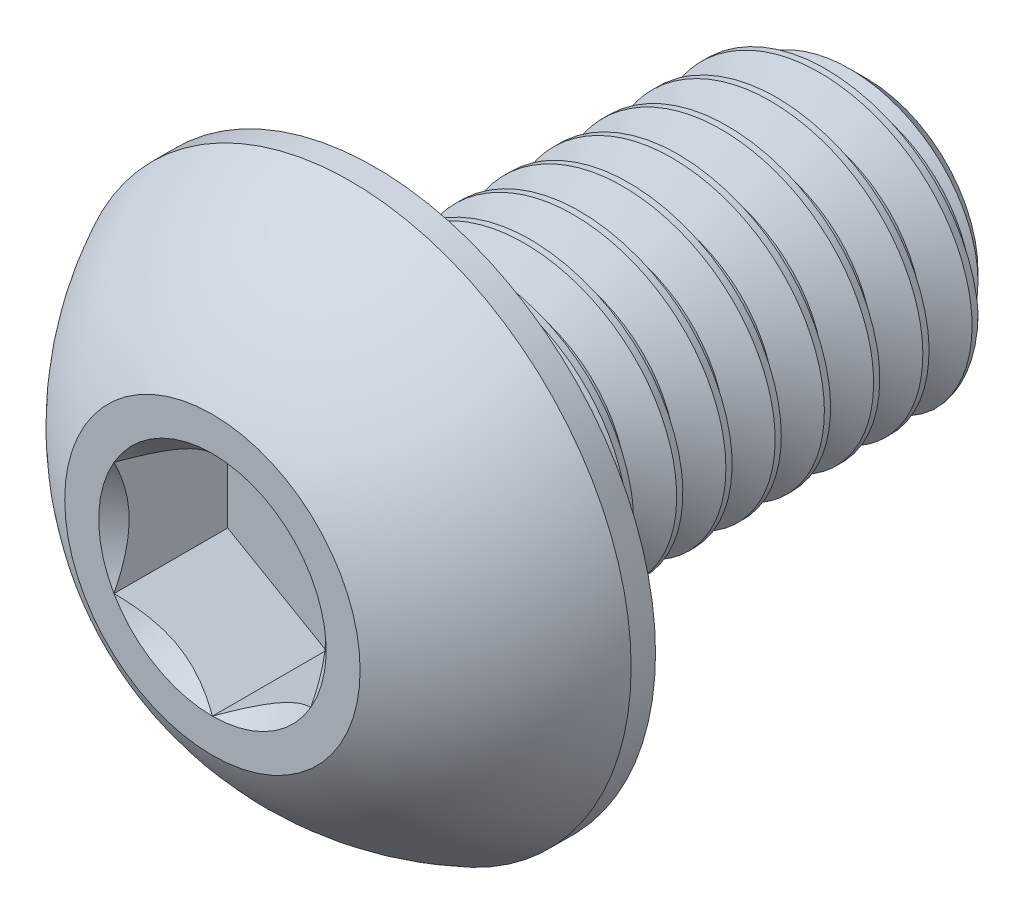
from build123d import *

# Parameters (mm, degrees)
SKETCH1_W              = 5
SKETCH1_H              = 1.5
CUT_EXTRUDE2_DEPTH     = 1.155
SPLIT1_SURFACE_1_BACK  = 11.45
SPLIT1_SURFACE_1_DEPTH = 22.9
SPLIT1_SURFACE_2_BACK  = 11.45
SPLIT1_SURFACE_2_DEPTH = 22.9
CHAMFER1_SIZE          = 0.375
CUT_SWEEP1_PITCH       = 0.5


with BuildPart() as part:
    # Sketch1 → Revolve1 (revolve)
    with BuildSketch(Plane(origin=(0, 0, 0), x_dir=(0, 0, -1), z_dir=(1, 0, 0))):
        with Locations((4.15, 0.75)):
            Rectangle(SKETCH1_W, SKETCH1_H)
    revolve(axis=Axis((0, 0, -6.65), (0, 0, 1)))

    # Sketch7 → Revolve2 (revolve)
    with BuildSketch(Plane(origin=(0, 0, 0), x_dir=(0, 0, -1), z_dir=(1, 0, 0)), mode=Mode.PRIVATE) as revolve2_sk:
        with BuildLine():
            Line((1.4025, 2.85), (1.65, 2.85))
            Line((1.65, 2.85), (1.65, 0))
            Line((1.65, 0), (0, 0))
            Line((0, 0), (0, 1.5))
            ThreePointArc((0, 1.5), (0.59512511, 2.285251969), (1.4025, 2.85))
        make_face()
    revolve(revolve2_sk.sketch.rotate(Axis((0, 0, 0), (0, 0, -1)), 180), axis=Axis((0, 0, 0), (0, 0, -1)))

    # Sketch5 → Cut-Extrude2 (cut)
    with BuildSketch(Plane.XY):
        Polygon((1, -0.577350269), (1, 0.577350269), (0, 1.154700538), (-1, 0.577350269), (-1, -0.577350269), (0, -1.154700538), align=None)
    extrude(amount=-CUT_EXTRUDE2_DEPTH, mode=Mode.SUBTRACT)

    # Cut-Extrude3 cone 1 section (through the dimple's axis) → Cut-Extrude3 (revolve, cut)
    with BuildSketch(Plane(origin=(0, 0, 0), x_dir=(0, -1, 0), z_dir=(1, 0, 0))):
        Polygon((0, 0), (1.154700538, 0), (0, 1.154700538), align=None)
    revolve(axis=Axis((0, 0, 0), (0, 0, -1)), mode=Mode.SUBTRACT)


with BuildPart() as body_2:
    # Split1: the piece behind the surface
    add(part.part)
    # Split1 surface: a surface, the sketch's curves swept straight by 22.9 mm
    with BuildLine(Plane(origin=(0, 0, 0), x_dir=(0, 0, -1), z_dir=(1, 0, 0)).offset(-SPLIT1_SURFACE_1_BACK), mode=Mode.PRIVATE) as split1_surface_1_path:
        Line((1.65, -2.85), (1.65, 2.85))
    split1_surface_1 = Shell.extrude(split1_surface_1_path.wire(), (1 * SPLIT1_SURFACE_1_DEPTH, 0 * SPLIT1_SURFACE_1_DEPTH, 0 * SPLIT1_SURFACE_1_DEPTH))
    split(bisect_by=split1_surface_1, keep=Keep.BOTTOM)

    # Chamfer1
    chamfer1_edges = [body_2.edges().sort_by_distance(p)[0] for p in [
        (0, -1.5, -6.65),
    ]]
    chamfer(chamfer1_edges, length=CHAMFER1_SIZE)

    # Cut-Sweep1: the profile of Sketch2 screwed along a right-hand helix of 11 turns, 6 arcs to a turn; built about Z, then put on its axis
    cut_sweep1_z = Axis((0, 0, 0), (0, 0, 1))
    cut_sweep1_corners = [(1.175240474, 0, -0.1875), (1.175240474, 0, -0.25), (1.527063294, 0, -0.453125), (1.527063294, 0, 0.015625)]
    with BuildLine(mode=Mode.PRIVATE) as cut_sweep1_profile:
        Line(cut_sweep1_corners[0], cut_sweep1_corners[1])
        Line(cut_sweep1_corners[1], cut_sweep1_corners[2])
        Line(cut_sweep1_corners[2], cut_sweep1_corners[3])
        Line(cut_sweep1_corners[3], cut_sweep1_corners[0])
    cut_sweep1_cap = Face(cut_sweep1_profile.wire())
    cut_sweep1_turn_angles = [0, 30, 60, 90, 120, 150, 180, 210, 240, 270, 300, 330, 360]
    cut_sweep1_turn_weights = [1, 0.8660254037844387, 1, 0.8660254037844387, 1, 0.8660254037844387, 1, 0.8660254037844387, 1, 0.8660254037844387, 1, 0.8660254037844387, 1]
    cut_sweep1_turn_rails = [Edge.make_bspline([Vector(p[0], p[1], 0).rotate(cut_sweep1_z, cut_sweep1_turn_angles[k]) / cut_sweep1_turn_weights[k] + Vector(0, 0, p[2] + CUT_SWEEP1_PITCH * cut_sweep1_turn_angles[k] / 360) for k in range(13)], [0, 0, 0, 1, 1, 2, 2, 3, 3, 4, 4, 5, 5, 6, 6, 6], 2, cut_sweep1_turn_weights) for p in cut_sweep1_corners]
    cut_sweep1_turn_sides = [Face.make_surface_from_curves(cut_sweep1_turn_rails[p[0]], cut_sweep1_turn_rails[p[1]]) for p in [(0, 1), (1, 2), (2, 3), (3, 0)]]
    cut_sweep1 = Plane(origin=(0, 0, -6.65), x_dir=(0, 1, 0), z_dir=(0, 0, 1)) * Solid(Shell([*[p.moved(Location((0, 0, CUT_SWEEP1_PITCH * i))) for i in range(11) for p in cut_sweep1_turn_sides], cut_sweep1_cap, cut_sweep1_cap.rotate(cut_sweep1_z, 3960).moved(Location((0, 0, CUT_SWEEP1_PITCH * 3960 / 360)))]))
    add(cut_sweep1, mode=Mode.SUBTRACT)


with BuildPart() as part_1:
    add(part.part)

    # Split1: split by a surface, the side it looks to stays
    # Split1 surface: a surface, the sketch's curves swept straight by 22.9 mm
    with BuildLine(Plane(origin=(0, 0, 0), x_dir=(0, 0, -1), z_dir=(1, 0, 0)).offset(-SPLIT1_SURFACE_2_BACK), mode=Mode.PRIVATE) as split1_surface_2_path:
        Line((1.65, -2.85), (1.65, 2.85))
    split1_surface_2 = Shell.extrude(split1_surface_2_path.wire(), (1 * SPLIT1_SURFACE_2_DEPTH, 0 * SPLIT1_SURFACE_2_DEPTH, 0 * SPLIT1_SURFACE_2_DEPTH))
    split(bisect_by=split1_surface_2, keep=Keep.TOP)

    # Combine1: union body 2
    add(body_2.part)


solid = part_1.part
